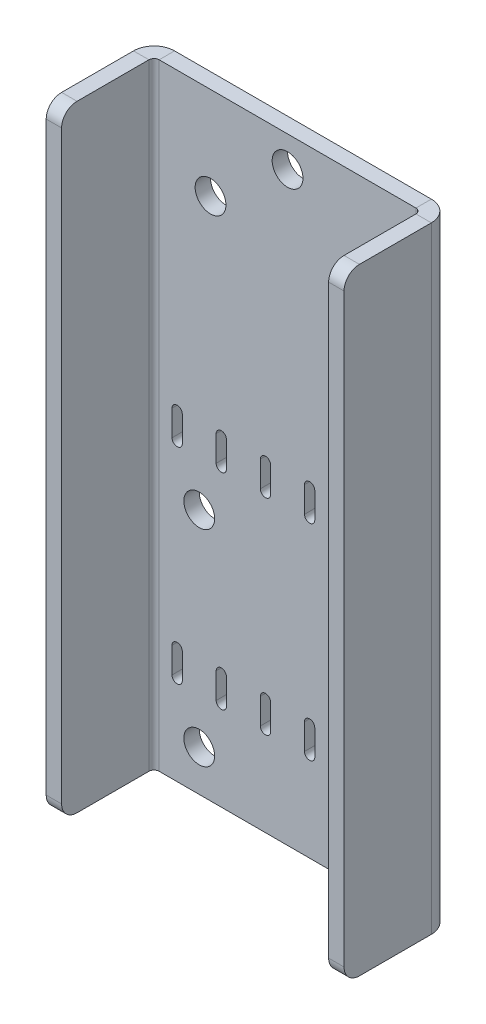
from build123d import *

# Parameters (mm, degrees)
BASE_FLANGE1_DEPTH = 120
CUT_EXTRUDE1_REACH = 126.76
SKETCH6_R          = 3
LPATTERN1_COUNT    = 2
LPATTERN1_PITCH    = 40
FILLET1_R          = 3
CUT_EXTRUDE2_REACH = 126.76
SKETCH7_R          = 3


# Sheet-metal steps are written as plain solids
with BuildPart() as part:
    # Sketch1 → Base-Flange1 (new body)
    with BuildSketch(Plane(origin=(0, 0, 0), x_dir=(1, 0, 0), z_dir=(0, 1, 0))):
        with BuildLine():
            Line((-26, -18), (-26, -1))
            ThreePointArc((-26, -1), (-25.707106781, -0.292893219), (-25, 0))
            Line((-25, 0), (25, 0))
            ThreePointArc((25, 0), (25.707106781, -0.292893219), (26, -1))
            Line((26, -1), (26, -18))
            Line((26, -18), (29, -18))
            Line((29, -18), (29, -1))
            ThreePointArc((29, -1), (27.828427125, 1.828427125), (25, 3))
            Line((25, 3), (-25, 3))
            ThreePointArc((-25, 3), (-27.828427125, 1.828427125), (-29, -1))
            Line((-29, -1), (-29, -18))
            Line((-29, -18), (-26, -18))
        make_face()
    extrude(amount=BASE_FLANGE1_DEPTH)

    # Sketch6 → Cut-Extrude1 (cut, up to next)
    with BuildSketch(Plane.XY, mode=Mode.PRIVATE) as cut_extrude1_sk1:
        with Locations((-17.2, 8)):
            Circle(SKETCH6_R)
    cut_extrude1_tool1 = extrude(cut_extrude1_sk1.sketch, amount=-CUT_EXTRUDE1_REACH, mode=Mode.PRIVATE) & part.part
    # Sketch6 → Cut-Extrude1 (cut, up to next)
    with BuildSketch(Plane.XY, mode=Mode.PRIVATE) as cut_extrude1_sk2:
        with Locations((17.2, 8)):
            Circle(SKETCH6_R)
    cut_extrude1_tool2 = extrude(cut_extrude1_sk2.sketch, amount=-CUT_EXTRUDE1_REACH, mode=Mode.PRIVATE) & part.part
    # Sketch6 → Cut-Extrude1 (cut, up to next)
    with BuildSketch(Plane.XY, mode=Mode.PRIVATE) as cut_extrude1_sk3:
        with BuildLine():
            Line((-11.9, 22.5), (-11.9, 17.5))
            ThreePointArc((-11.9, 17.5), (-12.9, 16.5), (-13.9, 17.5))
            Line((-13.9, 17.5), (-13.9, 22.5))
            ThreePointArc((-13.9, 22.5), (-12.9, 23.5), (-11.9, 22.5))
        make_face()
    cut_extrude1_tool3 = extrude(cut_extrude1_sk3.sketch, amount=-CUT_EXTRUDE1_REACH, mode=Mode.PRIVATE) & part.part
    # Sketch6 → Cut-Extrude1 (cut, up to next)
    with BuildSketch(Plane.XY, mode=Mode.PRIVATE) as cut_extrude1_sk4:
        with BuildLine():
            Line((-22.5, 22.5), (-22.5, 17.5))
            ThreePointArc((-22.5, 17.5), (-21.5, 16.5), (-20.5, 17.5))
            Line((-20.5, 17.5), (-20.5, 22.5))
            ThreePointArc((-20.5, 22.5), (-21.5, 23.5), (-22.5, 22.5))
        make_face()
    cut_extrude1_tool4 = extrude(cut_extrude1_sk4.sketch, amount=-CUT_EXTRUDE1_REACH, mode=Mode.PRIVATE) & part.part
    # Sketch6 → Cut-Extrude1 (cut, up to next)
    with BuildSketch(Plane.XY, mode=Mode.PRIVATE) as cut_extrude1_sk5:
        with BuildLine():
            Line((5.3, 22.5), (5.3, 17.5))
            ThreePointArc((5.3, 17.5), (4.3, 16.5), (3.3, 17.5))
            Line((3.3, 17.5), (3.3, 22.5))
            ThreePointArc((3.3, 22.5), (4.3, 23.5), (5.3, 22.5))
        make_face()
    cut_extrude1_tool5 = extrude(cut_extrude1_sk5.sketch, amount=-CUT_EXTRUDE1_REACH, mode=Mode.PRIVATE) & part.part
    # Sketch6 → Cut-Extrude1 (cut, up to next)
    with BuildSketch(Plane.XY, mode=Mode.PRIVATE) as cut_extrude1_sk6:
        with BuildLine():
            Line((-5.3, 22.5), (-5.3, 17.5))
            ThreePointArc((-5.3, 17.5), (-4.3, 16.5), (-3.3, 17.5))
            Line((-3.3, 17.5), (-3.3, 22.5))
            ThreePointArc((-3.3, 22.5), (-4.3, 23.5), (-5.3, 22.5))
        make_face()
    cut_extrude1_tool6 = extrude(cut_extrude1_sk6.sketch, amount=-CUT_EXTRUDE1_REACH, mode=Mode.PRIVATE) & part.part
    # Sketch6 → Cut-Extrude1 (cut, up to next)
    with BuildSketch(Plane.XY, mode=Mode.PRIVATE) as cut_extrude1_sk7:
        with BuildLine():
            Line((22.5, 22.5), (22.5, 17.5))
            ThreePointArc((22.5, 17.5), (21.5, 16.5), (20.5, 17.5))
            Line((20.5, 17.5), (20.5, 22.5))
            ThreePointArc((20.5, 22.5), (21.5, 23.5), (22.5, 22.5))
        make_face()
    cut_extrude1_tool7 = extrude(cut_extrude1_sk7.sketch, amount=-CUT_EXTRUDE1_REACH, mode=Mode.PRIVATE) & part.part
    # Sketch6 → Cut-Extrude1 (cut, up to next)
    with BuildSketch(Plane.XY, mode=Mode.PRIVATE) as cut_extrude1_sk8:
        with BuildLine():
            Line((11.9, 22.5), (11.9, 17.5))
            ThreePointArc((11.9, 17.5), (12.9, 16.5), (13.9, 17.5))
            Line((13.9, 17.5), (13.9, 22.5))
            ThreePointArc((13.9, 22.5), (12.9, 23.5), (11.9, 22.5))
        make_face()
    cut_extrude1_tool8 = extrude(cut_extrude1_sk8.sketch, amount=-CUT_EXTRUDE1_REACH, mode=Mode.PRIVATE) & part.part
    cut_extrude1_1 = cut_extrude1_tool1.solids().sort_by_distance((-17.2, 8, 0))[0]
    add(cut_extrude1_1, mode=Mode.SUBTRACT)
    cut_extrude1_2 = cut_extrude1_tool2.solids().sort_by_distance((17.2, 8, 0))[0]
    add(cut_extrude1_2, mode=Mode.SUBTRACT)
    cut_extrude1_3 = cut_extrude1_tool3.solids().sort_by_distance((-12.9, 20, 0))[0]
    add(cut_extrude1_3, mode=Mode.SUBTRACT)
    cut_extrude1_4 = cut_extrude1_tool4.solids().sort_by_distance((-21.5, 20, 0))[0]
    add(cut_extrude1_4, mode=Mode.SUBTRACT)
    cut_extrude1_5 = cut_extrude1_tool5.solids().sort_by_distance((4.3, 20, 0))[0]
    add(cut_extrude1_5, mode=Mode.SUBTRACT)
    cut_extrude1_6 = cut_extrude1_tool6.solids().sort_by_distance((-4.3, 20, 0))[0]
    add(cut_extrude1_6, mode=Mode.SUBTRACT)
    cut_extrude1_7 = cut_extrude1_tool7.solids().sort_by_distance((21.5, 20, 0))[0]
    add(cut_extrude1_7, mode=Mode.SUBTRACT)
    cut_extrude1_8 = cut_extrude1_tool8.solids().sort_by_distance((12.9, 20, 0))[0]
    add(cut_extrude1_8, mode=Mode.SUBTRACT)
    cut_extrude1 = cut_extrude1_1 + cut_extrude1_2 + cut_extrude1_3 + cut_extrude1_4 + cut_extrude1_5 + cut_extrude1_6 + cut_extrude1_7 + cut_extrude1_8  # Cut-Extrude1 as one shape, for the pattern or mirror that repeats it

    # LPattern1: Cut-Extrude1 ×2
    with Locations(*[(0, i * LPATTERN1_PITCH, 0) for i in range(1, LPATTERN1_COUNT)]):
        add(cut_extrude1, mode=Mode.SUBTRACT)

    # Fillet1
    fillet1_edges = [part.edges().sort_by_distance(p)[0] for p in [
        (27.5, 0, 18),
        (-27.5, 0, 18),
        (27.5, 120, 18),
        (-27.5, 120, 18),
    ]]
    fillet(fillet1_edges, radius=FILLET1_R)

    # Sketch7 → Cut-Extrude2 (cut, up to next)
    with BuildSketch(Plane.XY, mode=Mode.PRIVATE) as cut_extrude2_sk1:
        with Locations((0, 114)):
            Circle(SKETCH7_R)
    cut_extrude2_tool1 = extrude(cut_extrude2_sk1.sketch, amount=-CUT_EXTRUDE2_REACH, mode=Mode.PRIVATE) & part.part
    # Sketch7 → Cut-Extrude2 (cut, up to next)
    with BuildSketch(Plane.XY, mode=Mode.PRIVATE) as cut_extrude2_sk2:
        with Locations((-15, 102)):
            Circle(SKETCH7_R)
    cut_extrude2_tool2 = extrude(cut_extrude2_sk2.sketch, amount=-CUT_EXTRUDE2_REACH, mode=Mode.PRIVATE) & part.part
    # Sketch7 → Cut-Extrude2 (cut, up to next)
    with BuildSketch(Plane.XY, mode=Mode.PRIVATE) as cut_extrude2_sk3:
        with Locations((15, 102)):
            Circle(SKETCH7_R)
    cut_extrude2_tool3 = extrude(cut_extrude2_sk3.sketch, amount=-CUT_EXTRUDE2_REACH, mode=Mode.PRIVATE) & part.part
    add(cut_extrude2_tool1.solids().sort_by_distance((0, 114, 0))[0], mode=Mode.SUBTRACT)
    add(cut_extrude2_tool2.solids().sort_by_distance((-15, 102, 0))[0], mode=Mode.SUBTRACT)
    add(cut_extrude2_tool3.solids().sort_by_distance((15, 102, 0))[0], mode=Mode.SUBTRACT)


solid = part.part
